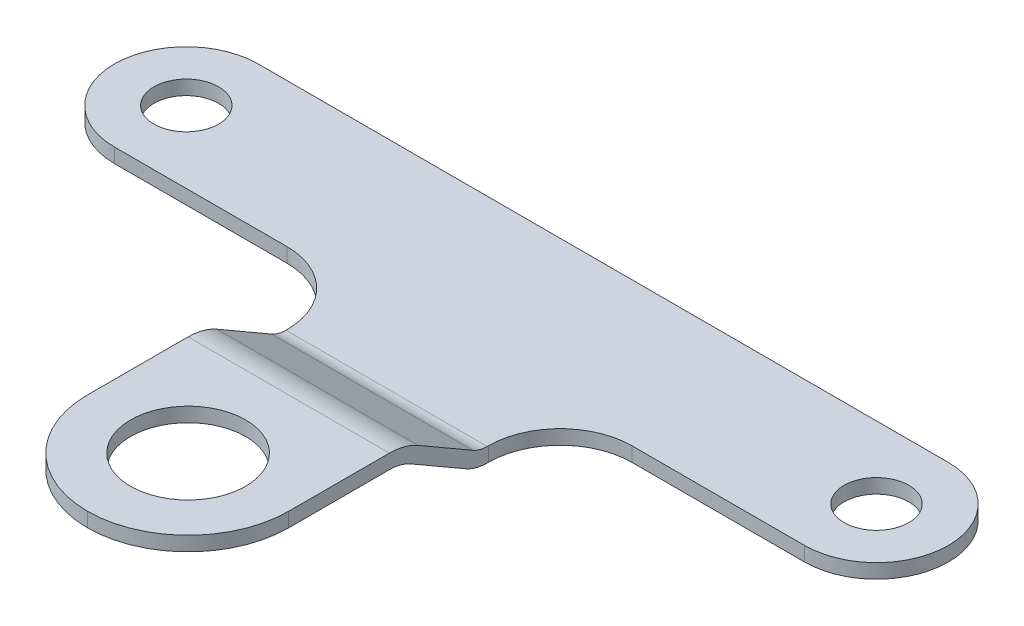
from build123d import *

# Parameters (mm, degrees)
EXTRUDE_THIN1_DEPTH     = 7
FILLET1_R               = 7
CUT_EXTRUDE1_DEPTH      = 10
CUT_EXTRUDE1_DEPTH_BACK = 10
SKETCH2_R               = 4
SKETCH3_R               = 2.25
BOSS_EXTRUDE1_DEPTH     = 1
FILLET2_R               = 5


with BuildPart() as part:
    # Sketch1 → Extrude-Thin1 (new, symmetric)
    with BuildSketch(Plane(origin=(0, 0, 0), x_dir=(0, 0, -1), z_dir=(1, 0, 0))):
        with BuildLine():
            Line((0, 0), (-15.070934652, 0))
            ThreePointArc((-15.070934652, 0), (-15.847391787, 0.102222521), (-16.570934652, 0.401923789))
            Line((-16.570934652, 0.401923789), (-20.374782229, 2.598076211))
            ThreePointArc((-20.374782229, 2.598076211), (-21.098325094, 2.897777479), (-21.874782229, 3))
            Line((-21.874782229, 3), (-35.874782229, 3))
            Line((-35.874782229, 3), (-35.874782229, 4))
            Line((-35.874782229, 4), (-21.874782229, 4))
            ThreePointArc((-21.874782229, 4), (-20.839506049, 3.863703305), (-19.874782229, 3.464101615))
            Line((-19.874782229, 3.464101615), (-16.070934652, 1.267949192))
            ThreePointArc((-16.070934652, 1.267949192), (-15.588572742, 1.068148347), (-15.070934652, 1))
            Line((-15.070934652, 1), (0, 1))
            Line((0, 1), (0, 0))
        make_face()
    extrude(amount=EXTRUDE_THIN1_DEPTH, both=True)

    # Fillet1
    fillet1_edges = [part.edges().sort_by_distance(p)[0] for p in [
        (-7, 3.5, 35.874782229),
        (7, 3.5, 35.874782229),
    ]]
    fillet(fillet1_edges, radius=FILLET1_R - 0.0001)  # a hair under: the kernel refuses the full size

    # Sketch2 → Cut-Extrude1 (cut, two sides: drawn at the far end of the back side and taken through both)
    with BuildSketch(Plane(origin=(0, 1, 0), x_dir=(1, 0, 0), z_dir=(0, 1, 0)).offset(-CUT_EXTRUDE1_DEPTH_BACK)):
        with Locations(Location((0, -28.874782229, 0), (0, 0, 90))):
            Circle(SKETCH2_R)
    extrude(amount=CUT_EXTRUDE1_DEPTH + CUT_EXTRUDE1_DEPTH_BACK, mode=Mode.SUBTRACT)

    # Sketch3 → Boss-Extrude1 (add)
    with BuildSketch(Plane.XZ):
        with BuildLine():
            Line((24, 0), (-24, 0))
            ThreePointArc((-24, 0), (-29, 5), (-24, 10))
            Line((-24, 10), (24, 10))
            ThreePointArc((24, 10), (29, 5), (24, 0))
        make_face()
        with Locations(Location((24, 5, 0), (0, 0, 270))):
            Circle(SKETCH3_R, mode=Mode.SUBTRACT)
        with Locations(Location((-24, 5, 0), (0, 0, 270))):
            Circle(SKETCH3_R, mode=Mode.SUBTRACT)
    extrude(amount=-BOSS_EXTRUDE1_DEPTH)

    # Fillet2
    fillet2_edges = [part.edges().sort_by_distance(p)[0] for p in [
        (-7, 0.5, 10),
        (7, 0.5, 10),
    ]]
    fillet(fillet2_edges, radius=FILLET2_R)


solid = part.part
